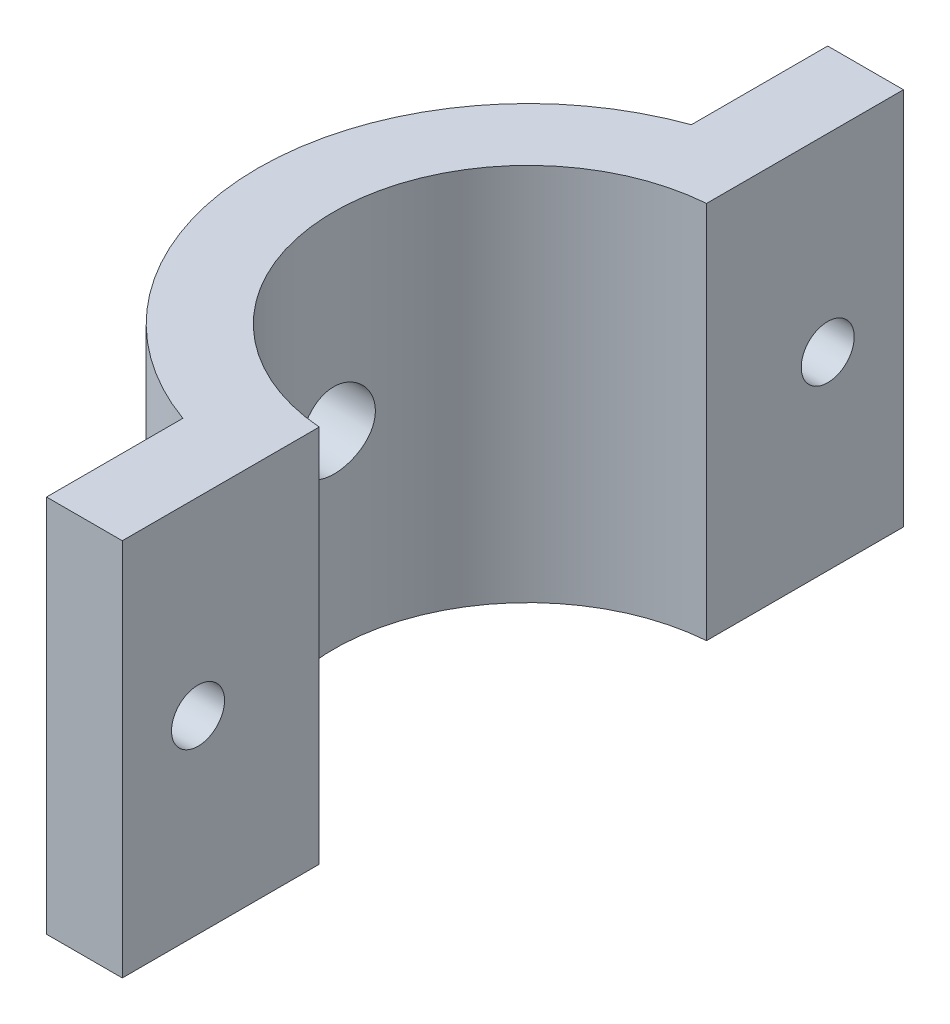
from build123d import *

# Parameters (mm, degrees)
BOSS_EXTRUDE4_DEPTH = 25
SKETCH7_R           = 1.75
CUT_EXTRUDE1_DEPTH  = 40.660285517
BOSS_EXTRUDE5_START = -15
SKETCH8_R           = 5
BOSS_EXTRUDE5_DEPTH = 5
SKETCH9_R           = 2.5
CUT_EXTRUDE2_DEPTH  = 41.630747314


with BuildPart() as part:
    # Sketch6 → Boss-Extrude4 (new body)
    with BuildSketch(Plane.XZ):
        with BuildLine():
            Line((-1, 25.784833184), (-1, 12.785954208))
            ThreePointArc((-1, 12.785954208), (-12.825, 0), (-1, -12.785954208))
            Line((-1, -12.785954208), (-1, -25.784833184))
            Line((-1, -25.784833184), (-6, -25.784833184))
            Line((-6, -25.784833184), (-6, -16.784833184))
            ThreePointArc((-6, -16.784833184), (-17.825, 0), (-6, 16.784833184))
            Line((-6, 16.784833184), (-6, 25.784833184))
            Line((-6, 25.784833184), (-1, 25.784833184))
        make_face()
    extrude(amount=BOSS_EXTRUDE4_DEPTH)

    # Sketch7 → Cut-Extrude1 (cut, through all)
    with BuildSketch(Plane(origin=(-1, 0, 0), x_dir=(0, 0, -1), z_dir=(1, 0, 0))):
        with Locations((-20.784833184, -12.5)):
            Circle(SKETCH7_R)
        with Locations((20.784833184, -12.5)):
            Circle(SKETCH7_R)
    extrude(amount=-CUT_EXTRUDE1_DEPTH, mode=Mode.SUBTRACT)

    # Sketch8 → Boss-Extrude5 (add)
    with BuildSketch(Plane(origin=(0, 0, 0), x_dir=(0, 0, -1), z_dir=(1, 0, 0)).offset(BOSS_EXTRUDE5_START)):
        with Locations((0, -12.5)):
            Circle(SKETCH8_R)
    extrude(amount=-BOSS_EXTRUDE5_DEPTH)

    # Sketch9 → Cut-Extrude2 (cut, through all)
    with BuildSketch(Plane.ZY.offset(20)):
        with Locations((0, -12.5)):
            Circle(SKETCH9_R)
    extrude(amount=-CUT_EXTRUDE2_DEPTH, mode=Mode.SUBTRACT)


solid = part.part
